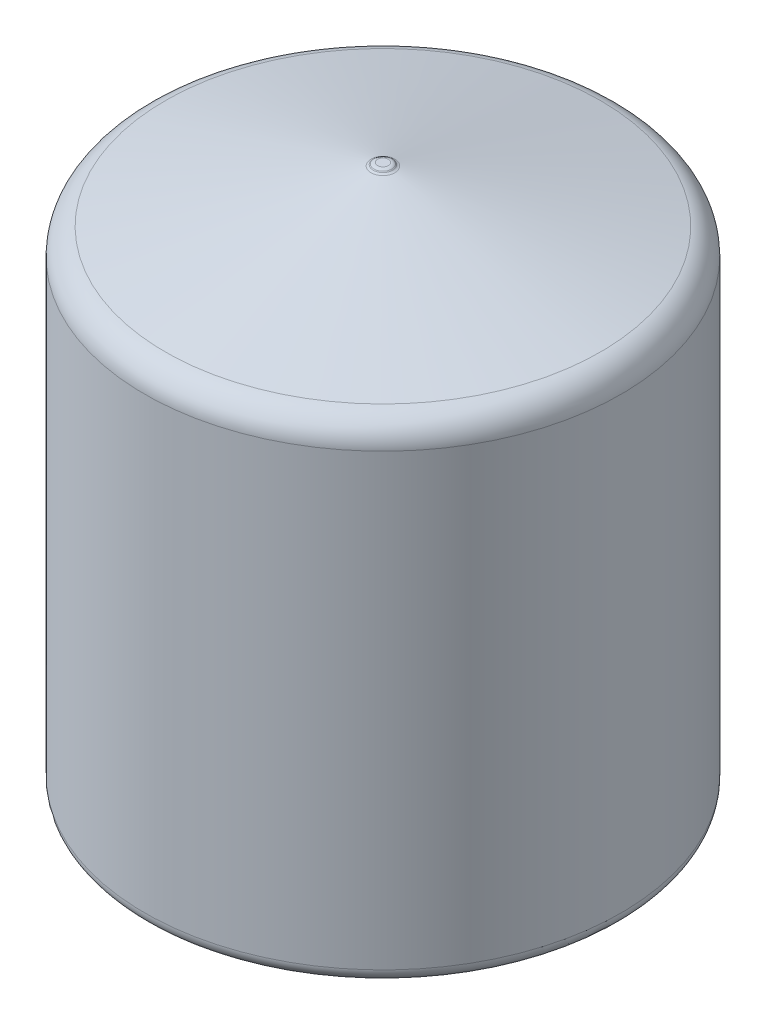
from build123d import *

# Parameters (mm, degrees)
FILLET1_R = 0.5


with BuildPart() as part:
    # Sketch1 → Revolve1 (revolve)
    with BuildSketch(Plane.XY, mode=Mode.PRIVATE) as revolve1_sk:
        with BuildLine():
            Line((7.75, 0), (7.75, 17))
            Line((7.75, 17), (0.712765957, 18.787234043))
            Line((0.712765957, 18.787234043), (0, 19.5))
            Line((0, 19.5), (0, 20))
            Line((0, 20), (0.2, 20))
            ThreePointArc((0.2, 20), (0.268166817, 19.988024693), (0.328170449, 19.95353285))
            Line((0.328170449, 19.95353285), (0.356771445, 19.92965651))
            ThreePointArc((0.356771445, 19.92965651), (0.393979876, 19.905071671), (0.435711125, 19.889343206))
            Line((0.435711125, 19.889343206), (7.996153846, 17.969230769))
            ThreePointArc((7.996153846, 17.969230769), (8.539352217, 17.613940614), (8.75, 17))
            Line((8.75, 17), (8.75, 0))
            Line((8.75, 0), (7.75, 0))
        make_face()
    revolve(revolve1_sk.sketch.rotate(Axis((0, 9.5, 0), (0, -1, 0)), 270), axis=Axis((0, 9.5, 0), (0, -1, 0)))

    # Fillet1
    fillet1_edges = [part.edges().sort_by_distance(p)[0] for p in [
        (0, 0, 8.75),
        (0, 0, 7.75),
    ]]
    fillet(fillet1_edges, radius=FILLET1_R - 0.0001)  # a hair under: the kernel refuses the full size


solid = part.part
